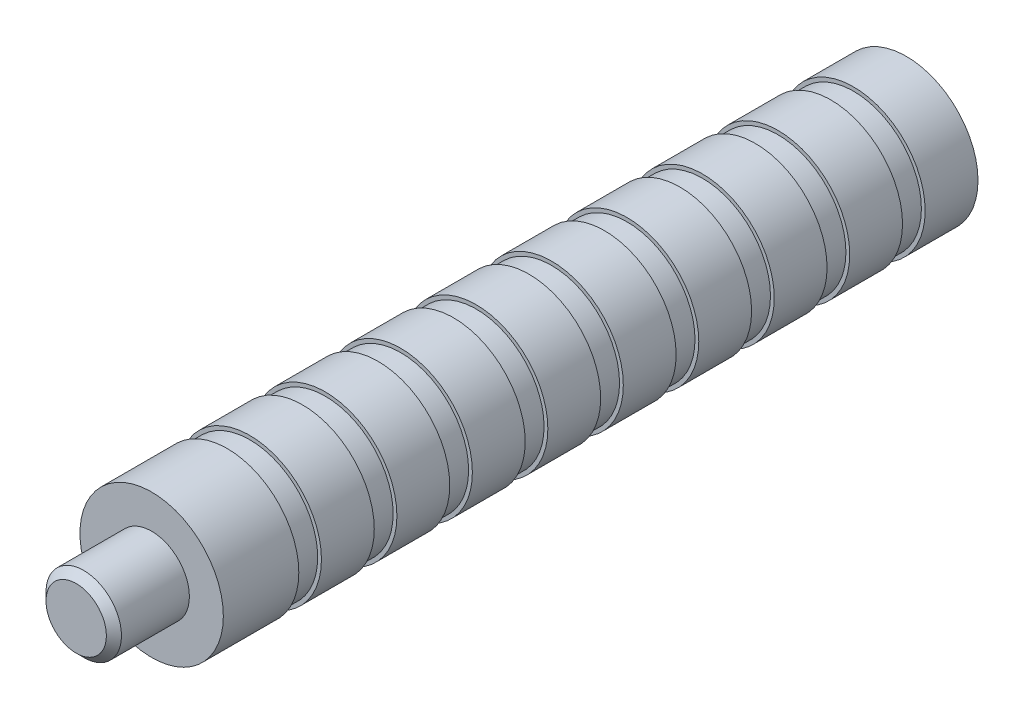
from build123d import *

# Parameters (mm, degrees)
CUT_EXTRUDE1_DEPTH  = 14
SKETCH4_R           = 2.5
BOSS_EXTRUDE2_DEPTH = 5
CHAMFER1_SIZE       = 0.5


with BuildPart() as part:
    # Sketch2 → Revolve2 (revolve)
    with BuildSketch(Plane(origin=(0, 0, 0), x_dir=(0, 0, -1), z_dir=(1, 0, 0))):
        Polygon((-25, 0), (25, 0), (25, 4.75), (21.5, 4.75), (21.5, 4.5), (20, 4.5), (20, 4.75), (16.5, 4.75), (16.5, 4.5), (15, 4.5), (15, 4.75), (11.5, 4.75), (11.5, 4.5), (10, 4.5), (10, 4.75), (6.5, 4.75), (6.5, 4.5), (5, 4.5), (5, 4.75), (1.5, 4.75), (1.5, 4.5), (0, 4.5), (0, 4.75), (-3.5, 4.75), (-3.5, 4.5), (-5, 4.5), (-5, 4.75), (-8.5, 4.75), (-8.5, 4.5), (-10, 4.5), (-10, 4.75), (-13.5, 4.75), (-13.5, 4.5), (-15, 4.5), (-15, 4.75), (-18.5, 4.75), (-18.5, 4.5), (-20, 4.5), (-20, 4.75), (-25, 4.75), align=None)
    revolve(axis=Axis((0, 0, -25), (0, 0, -1)))

    # Sketch3 → Cut-Extrude1 (cut)
    with BuildSketch(Plane(origin=(0, 0, -25), x_dir=(-1, 0, 0), z_dir=(0, 0, -1))):
        with BuildLine():
            Line((1.75, 0.968245837), (1.75, -0.968245837))
            ThreePointArc((1.75, -0.968245837), (-2, 0), (1.75, 0.968245837))
        make_face()
    extrude(amount=-CUT_EXTRUDE1_DEPTH, mode=Mode.SUBTRACT)

    # Sketch4 → Boss-Extrude2 (add)
    with BuildSketch(Plane.XY.offset(25)):
        Circle(SKETCH4_R)
    extrude(amount=BOSS_EXTRUDE2_DEPTH)

    # Chamfer1
    chamfer1_edges = [part.edges().sort_by_distance(p)[0] for p in [
        (-2.5, 0, 30),
    ]]
    chamfer(chamfer1_edges, length=CHAMFER1_SIZE)


solid = part.part
